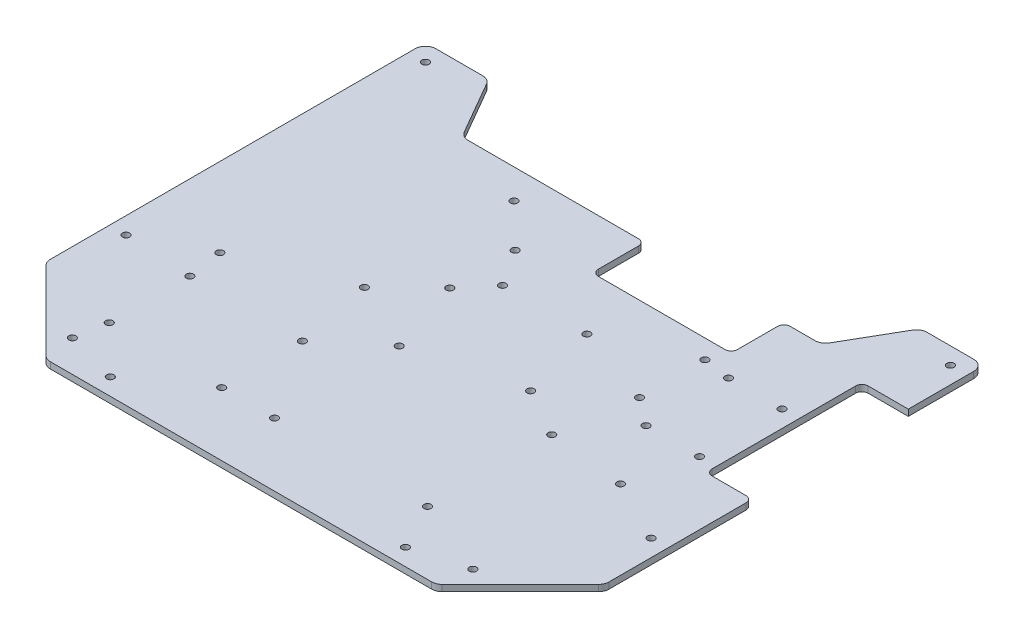
from build123d import *

# Parameters (mm, degrees)
BOSS_EXTRU_1_DEPTH           = 3
CONG_1_R                     = 5
ESQUISSE2_R                  = 1
ENL_V_MAT_EXTRU_1_DEPTH      = 3
D_GAGEMENT_M31_D             = 3.4
ESQUISSE5_W                  = 66
ESQUISSE5_H                  = 25
ESQUISSE5_W_2                = 22
ESQUISSE5_H_2                = 74
ENL_V_MAT_EXTRU_2_DEPTH      = 257.837010573
CONG_2_R                     = 3
ESQUISSE6_R                  = 1
ENL_V_MAT_EXTRU_3_DEPTH      = 257.837010573
D_GAGEMENT_M32_D             = 3.4
D_GAGEMENT_M32_DEPTH         = 10
D_GAGEMENT_M32_TIP           = 1.021463052
ESQUISSE9_R                  = 1
ENL_V_MAT_EXTRU_4_DEPTH      = 257.837010573
D_GAGEMENT_M33_D             = 3.4
D_GAGEMENT_M33_DEPTH         = 10
D_GAGEMENT_M33_TIP           = 1.021463052
ENL_V_MAT_EXTRU_5_DEPTH      = 257.837010573
ENL_V_MAT_EXTRU_5_DEPTH_BACK = 257.837010573
ESQUISSE12_R                 = 1
D_GAGEMENT_M34_D             = 3.4
D_GAGEMENT_M34_DEPTH         = 10
D_GAGEMENT_M34_TIP           = 1.021463052
D_GAGEMENT_M35_D             = 3.4
D_GAGEMENT_M35_DEPTH         = 10
D_GAGEMENT_M35_TIP           = 1.021463052


with BuildPart() as part:
    # Esquisse1 → Boss.-Extru.1 (new body)
    with BuildSketch(Plane(origin=(0, 0, 0), x_dir=(1, 0, 0), z_dir=(0, 1, 0))):
        Polygon((-92.5, 0), (92.5, 0), (132.5, 40), (132.5, 220), (102.5, 220), (85.179491924, 190), (-85.179491924, 190), (-102.5, 220), (-132.5, 220), (-132.5, 40), align=None)
    extrude(amount=BOSS_EXTRU_1_DEPTH)

    # Congé1
    cong_1_edges = [part.edges().sort_by_distance(p)[0] for p in [
        (92.5, 1.5, 0),
        (132.5, 1.5, -40),
        (132.5, 1.5, -220),
        (102.5, 1.5, -220),
        (85.179491924, 1.5, -190),
        (-85.179491924, 1.5, -190),
        (-102.5, 1.5, -220),
        (-132.5, 1.5, -220),
        (-92.5, 1.5, 0),
        (-132.5, 1.5, -40),
    ]]
    fillet(cong_1_edges, radius=CONG_1_R)

    # Esquisse2 → Enlèv. mat.-Extru.1 (cut)
    with BuildSketch(Plane(origin=(0, 3, 0), x_dir=(1, 0, 0), z_dir=(0, 1, 0))):
        with Locations((70, 8)):
            Circle(ESQUISSE2_R)
        with Locations((124.5, 70)):
            Circle(ESQUISSE2_R)
        with Locations((124.5, 212)):
            Circle(ESQUISSE2_R)
        with Locations((-124.5, 212)):
            Circle(ESQUISSE2_R)
        with Locations((-124.5, 70)):
            Circle(ESQUISSE2_R)
        with Locations((-70, 8)):
            Circle(ESQUISSE2_R)
    extrude(amount=-ENL_V_MAT_EXTRU_1_DEPTH, mode=Mode.SUBTRACT)

    # Dégagement M31 (through all)
    with Locations(Plane(origin=(0, 3, 0), x_dir=(1, 0, 0), z_dir=(0, 1, 0))):
        with Locations((70, 8), (-70, 8), (-124.5, 70), (-124.5, 212), (124.5, 212), (124.5, 70)):
            Hole(D_GAGEMENT_M31_D / 2)

    # Esquisse5 → Enlèv. mat.-Extru.2 (cut, through all)
    with BuildSketch(Plane(origin=(0, 3, 0), x_dir=(1, 0, 0), z_dir=(0, 1, 0))):
        with Locations((34.5, 177.5)):
            Rectangle(ESQUISSE5_W, ESQUISSE5_H)
        with Locations((121.5, 147)):
            Rectangle(ESQUISSE5_W_2, ESQUISSE5_H_2)
    extrude(amount=-ENL_V_MAT_EXTRU_2_DEPTH, mode=Mode.SUBTRACT)

    # Congé2
    cong_2_edges = [part.edges().sort_by_distance(p)[0] for p in [
        (132.5, 1.5, -110),
        (110.5, 1.5, -110),
        (110.5, 1.5, -184),
        (67.5, 1.5, -190),
        (67.5, 1.5, -165),
        (1.5, 1.5, -165),
        (1.5, 1.5, -190),
    ]]
    fillet(cong_2_edges, radius=CONG_2_R)

    # Esquisse6 → Enlèv. mat.-Extru.3 (cut, through all)
    with BuildSketch(Plane(origin=(0, 3, 0), x_dir=(1, 0, 0), z_dir=(0, 1, 0))):
        with Locations((64, 156)):
            Circle(ESQUISSE6_R)
        with Locations((-26, 156)):
            Circle(ESQUISSE6_R)
        with Locations((-46.5, 176)):
            Circle(ESQUISSE6_R)
        with Locations((64, 125)):
            Circle(ESQUISSE6_R)
        with Locations((-26, 125)):
            Circle(ESQUISSE6_R)
        with Locations((-46.5, 105)):
            Circle(ESQUISSE6_R)
    extrude(amount=-ENL_V_MAT_EXTRU_3_DEPTH, mode=Mode.SUBTRACT)

    # Dégagement M32
    with Locations(Plane(origin=(0, 3, 0), x_dir=(1, 0, 0), z_dir=(0, 1, 0))):
        with Locations((-46.5, 105), (-26, 125), (-26, 156), (-46.5, 176), (64, 156), (64, 125)):
            Hole(D_GAGEMENT_M32_D / 2, depth=D_GAGEMENT_M32_DEPTH)
            with Locations((0, 0, -(D_GAGEMENT_M32_DEPTH + D_GAGEMENT_M32_TIP / 2))):  # 118° drill point
                Cone(0, D_GAGEMENT_M32_D / 2, D_GAGEMENT_M32_TIP, mode=Mode.SUBTRACT)

    # Esquisse9 → Enlèv. mat.-Extru.4 (cut, through all)
    with BuildSketch(Plane(origin=(0, 3, 0), x_dir=(1, 0, 0), z_dir=(0, 1, 0))):
        with Locations((102.5, 115)):
            Circle(ESQUISSE9_R)
        with Locations((102.5, 154.12)):
            Circle(ESQUISSE9_R)
        with Locations((-92.5, 68.24)):
            Circle(ESQUISSE9_R)
        with Locations((-39.16, 68.24)):
            Circle(ESQUISSE9_R)
        with Locations((-39.16, 30)):
            Circle(ESQUISSE9_R)
        with Locations((-92.5, 30)):
            Circle(ESQUISSE9_R)
        with Locations((-14.16, 89.182)):
            Circle(ESQUISSE9_R)
        with Locations((58.445555666, 88.92798746)):
            Circle(ESQUISSE9_R)
        with Locations((-14.16, 30)):
            Circle(ESQUISSE9_R)
        with Locations((58.484, 30)):
            Circle(ESQUISSE9_R)
        with Locations((-14.554444334, 138.588593019)):
            Circle(ESQUISSE9_R)
        with Locations((25.445555666, 138.588593019)):
            Circle(ESQUISSE9_R)
        with Locations((35.445555666, 101.92798746)):
            Circle(ESQUISSE9_R)
        with Locations((77.1, 115)):
            Circle(ESQUISSE9_R)
        with Locations((77.1, 154.12)):
            Circle(ESQUISSE9_R)
    extrude(amount=-ENL_V_MAT_EXTRU_4_DEPTH, mode=Mode.SUBTRACT)

    # Dégagement M33
    with Locations(Plane(origin=(0, 3, 0), x_dir=(1, 0, 0), z_dir=(0, 1, 0))):
        with Locations((102.5, 115), (102.5, 154.12), (77.1, 154.12), (77.1, 115)):
            Hole(D_GAGEMENT_M33_D / 2, depth=D_GAGEMENT_M33_DEPTH)
            with Locations((0, 0, -(D_GAGEMENT_M33_DEPTH + D_GAGEMENT_M33_TIP / 2))):  # 118° drill point
                Cone(0, D_GAGEMENT_M33_D / 2, D_GAGEMENT_M33_TIP, mode=Mode.SUBTRACT)

    # Esquisse12 → Enlèv. mat.-Extru.5 (cut, two sides: drawn at the far end of the back side and taken through both)
    with BuildSketch(Plane(origin=(0, 3, 0), x_dir=(1, 0, 0), z_dir=(0, 1, 0)).offset(-ENL_V_MAT_EXTRU_5_DEPTH_BACK)):
        with Locations((-95, 85)):
            Circle(ESQUISSE12_R)
        with Locations((95, 85)):
            Circle(ESQUISSE12_R)
        with Locations((95, 15)):
            Circle(ESQUISSE12_R)
        with Locations((-95, 15)):
            Circle(ESQUISSE12_R)
    extrude(amount=ENL_V_MAT_EXTRU_5_DEPTH + ENL_V_MAT_EXTRU_5_DEPTH_BACK, mode=Mode.SUBTRACT)

    # Dégagement M34
    with Locations(Plane(origin=(0, 3, 0), x_dir=(1, 0, 0), z_dir=(0, 1, 0))):
        with Locations((-92.5, 68.24), (-92.5, 30), (-39.16, 30), (-39.16, 68.24), (-14.16, 30), (58.484, 30), (-14.16, 89.182), (58.445555666, 88.92798746), (35.445555666, 101.92798746), (25.445555666, 138.588593019), (-14.554444334, 138.588593019)):
            Hole(D_GAGEMENT_M34_D / 2, depth=D_GAGEMENT_M34_DEPTH)
            with Locations((0, 0, -(D_GAGEMENT_M34_DEPTH + D_GAGEMENT_M34_TIP / 2))):  # 118° drill point
                Cone(0, D_GAGEMENT_M34_D / 2, D_GAGEMENT_M34_TIP, mode=Mode.SUBTRACT)

    # Dégagement M35
    with Locations(Plane(origin=(0, 3, 0), x_dir=(1, 0, 0), z_dir=(0, 1, 0))):
        with Locations((-95, 15), (-95, 85), (95, 85), (95, 15)):
            Hole(D_GAGEMENT_M35_D / 2, depth=D_GAGEMENT_M35_DEPTH)
            with Locations((0, 0, -(D_GAGEMENT_M35_DEPTH + D_GAGEMENT_M35_TIP / 2))):  # 118° drill point
                Cone(0, D_GAGEMENT_M35_D / 2, D_GAGEMENT_M35_TIP, mode=Mode.SUBTRACT)


solid = part.part
